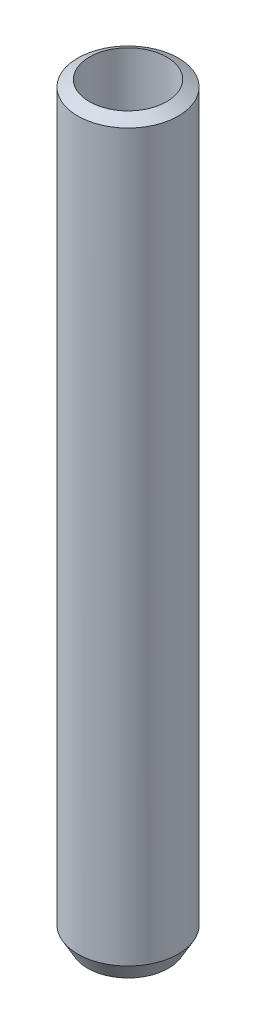
from build123d import *

# Parameters (mm, degrees)
SKETCH1_R           = 15
BOSS_EXTRUDE1_DEPTH = 224.642859
SKETCH2_R           = 11.538325124
CUT_EXTRUDE1_DEPTH  = 226.642225879
CHAMFER1_SIZE       = 2.968248
CHAMFER1_SIZE_2     = 5.183772


with BuildPart() as part:
    # Sketch1 → Boss-Extrude1 (new body)
    with BuildSketch(Plane(origin=(0, 0, 0), x_dir=(1, 0, 0), z_dir=(0, 1, 0))):
        with Locations(Location((0, 0, 0), (0, 0, 90))):
            Circle(SKETCH1_R)
    extrude(amount=BOSS_EXTRUDE1_DEPTH)

    # Sketch2 → Cut-Extrude1 (cut, through all)
    with BuildSketch(Plane(origin=(0, 0, 0), x_dir=(1, 0, 0), z_dir=(0, 1, 0))):
        with Locations(Location((0, 0, 0), (0, 0, 90))):
            Circle(SKETCH2_R)
    extrude(amount=CUT_EXTRUDE1_DEPTH, mode=Mode.SUBTRACT)

    # Chamfer1
    # the kernel refuses this chamfer: 5.183772, 2.968248 mm, written as the material it takes off along each edge
    with BuildSketch(Plane(origin=(0, 224.642859, 0), x_dir=(0, 0, -1), z_dir=(1, 0, 0))) as chamfer1_piece_1:
        Polygon((15, -CHAMFER1_SIZE), (15 - CHAMFER1_SIZE_2, 0), (15, 0), align=None)
    revolve(axis=Axis((0, 224.642859, 0), (0, 1, 0)), mode=Mode.SUBTRACT)
    with BuildSketch(Plane(origin=(0, 0, 0), x_dir=(0, 0, -1), z_dir=(1, 0, 0))) as chamfer1_piece_2:
        Polygon((15, CHAMFER1_SIZE_2), (15 - CHAMFER1_SIZE, 0), (15, 0), align=None)
    revolve(axis=Axis((0, 0, 0), (0, 1, 0)), mode=Mode.SUBTRACT)


solid = part.part
